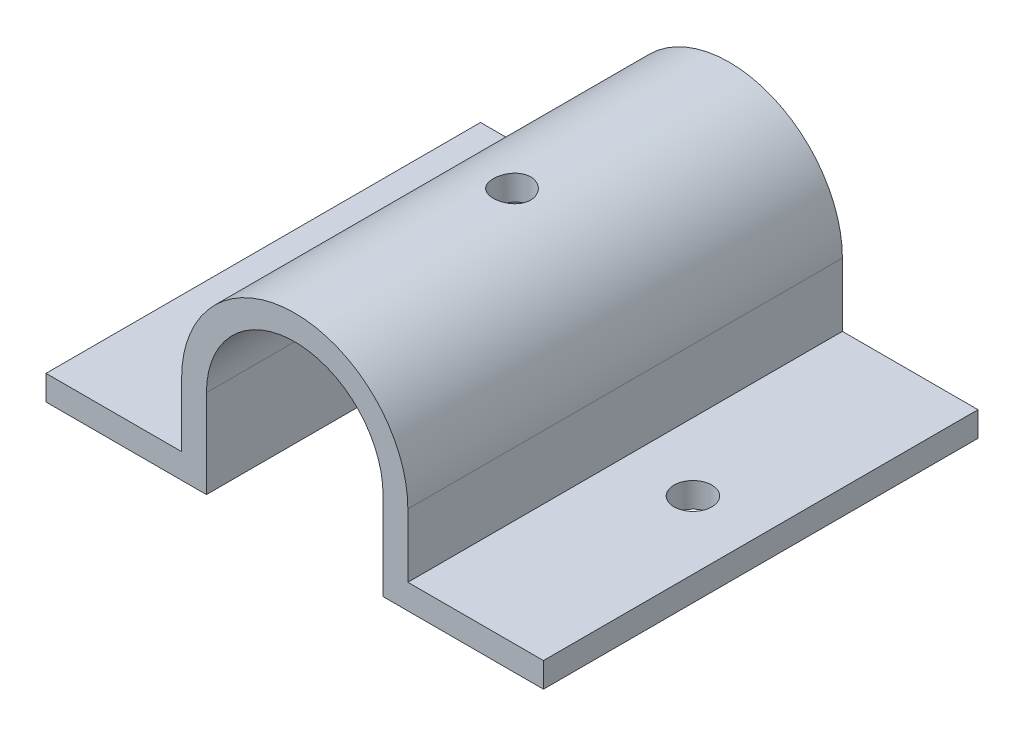
from build123d import *

# Parameters (mm, degrees)
BOSS_EXTRUDE1_DEPTH = 70
SKETCH2_R           = 3.048
CUT_EXTRUDE1_DEPTH  = 70
FILLET1_R           = 14.224
FILLET2_RADIUS      = 18.224
FILLET2_LENGTH      = 70
SKETCH3_R           = 3
CUT_EXTRUDE2_DEPTH  = 70


with BuildPart() as part:
    # Sketch1 → Boss-Extrude1 (new body)
    with BuildSketch(Plane.XY):
        Polygon((-40.068, 0), (-18.224, 0), (-18.224, 28.448), (18.224, 28.448), (18.224, 0), (40.068, 0), (40.068, -4), (14.224, -4), (14.224, 24.448), (-14.224, 24.448), (-14.224, -4), (-40.068, -4), align=None)
    extrude(amount=BOSS_EXTRUDE1_DEPTH)

    # Sketch2 → Cut-Extrude1 (cut)
    with BuildSketch(Plane(origin=(0, 0, 0), x_dir=(1, 0, 0), z_dir=(0, 1, 0))):
        with Locations(Location((-31.280253866, -35, 0), (0, 0, 180))):
            Circle(SKETCH2_R)
        with BuildLine():
            ThreePointArc((32.194, -35), (31.301261469, -32.844738531), (29.146, -31.952))
            Line((29.146, -31.952), (29.146, -38.048))
            ThreePointArc((29.146, -38.048), (31.301261469, -37.155261469), (32.194, -35))
        make_face()
        with BuildLine():
            Line((29.146, -38.048), (29.146, -31.952))
            ThreePointArc((29.146, -31.952), (26.098, -35), (29.146, -38.048))
        make_face()
    extrude(amount=-CUT_EXTRUDE1_DEPTH, mode=Mode.SUBTRACT)

    # Fillet1
    fillet1_edges = [part.edges().sort_by_distance(p)[0] for p in [
        (14.224, 24.448, 35),
        (-14.224, 24.448, 35),
    ]]
    fillet(fillet1_edges, radius=FILLET1_R - 0.0001)  # a hair under: the kernel refuses the full size

    # Fillet2: full round fillet: the end face becomes a half cylinder, R = half its width
    fillet2_face = Plane((0, 28.448, 35), x_dir=(0, 0, 1), z_dir=(0, 1, 0))  # on the end face: x along it, z out of the body
    fillet2_slab = fillet2_face.offset(-FILLET2_RADIUS / 2) * Box(FILLET2_LENGTH, 2 * FILLET2_RADIUS, FILLET2_RADIUS, mode=Mode.PRIVATE)  # the body's end, R deep
    fillet2_round = Plane((0, 10.224, 35), x_dir=(0, 1, 0), z_dir=(0, 0, 1)) * Cylinder(FILLET2_RADIUS, FILLET2_LENGTH, mode=Mode.PRIVATE)  # its axis R under the face
    add(fillet2_slab - fillet2_round, mode=Mode.SUBTRACT)

    # Sketch3 → Cut-Extrude2 (cut)
    with BuildSketch(Plane(origin=(0, 0, 0), x_dir=(1, 0, 0), z_dir=(0, 1, 0))):
        with Locations(Location((0, -35, 0), (0, 0, 90))):
            Circle(SKETCH3_R)
    extrude(amount=CUT_EXTRUDE2_DEPTH, mode=Mode.SUBTRACT)


solid = part.part
